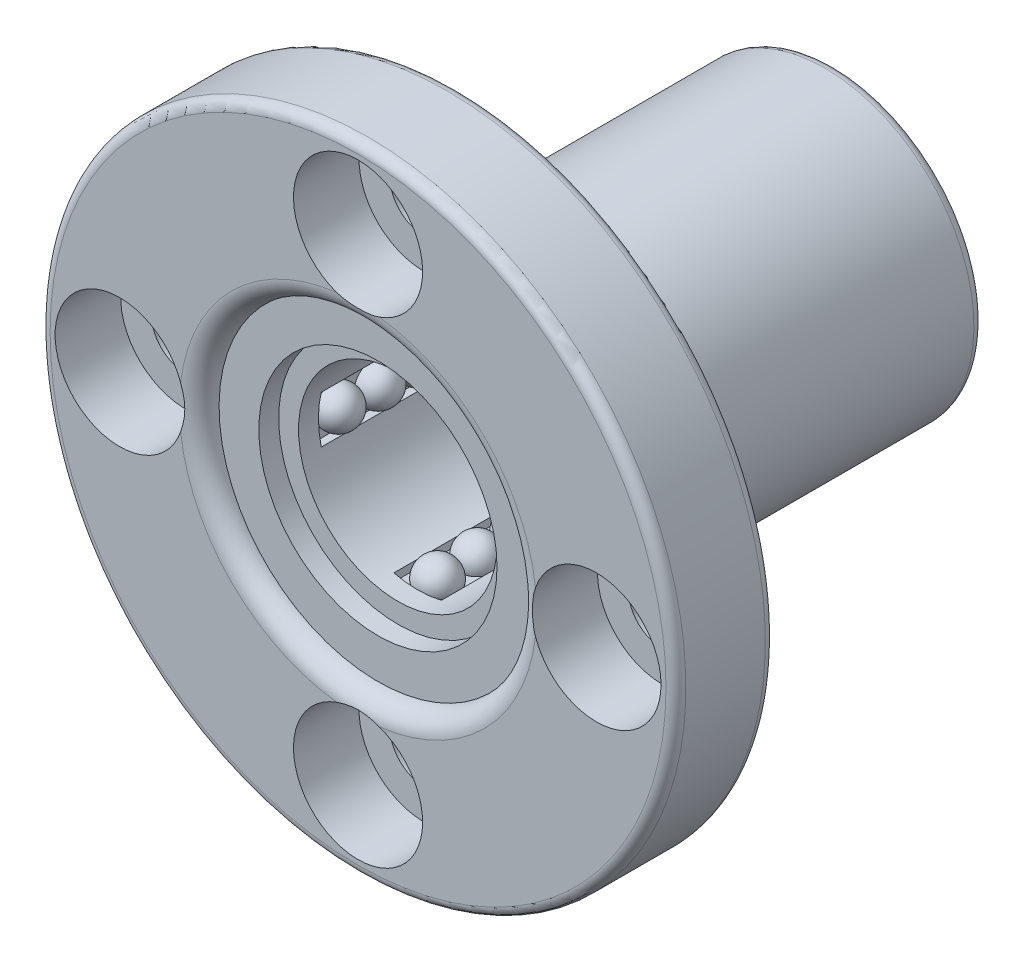
from build123d import *

# Parameters (mm, degrees)
REVOLVE_START            = -24
REVOLVE_1_OUTLINE_R      = 7.5
REVOLVE_1_DEPTH          = 24
REVOLVE_START_2          = -5
REVOLVE_1_2_OUTLINE_R    = 16
REVOLVE_1_2_OUTLINE_R_2  = 7.5
REVOLVE_1_2_DEPTH        = 5
SKETCH_16_R              = 3.25
CUT_EXTRUDE_11_DEPTH     = 3.3
SKETCH_17_R              = 1.7
CUT_EXTRUDE_12_DEPTH     = 5
SKETCH_4_R               = 4.995
CUT_EXTRUDE_1_DEPTH      = 24
SKETCH_5_R               = 7.995
CUT_EXTRUDE_2_DEPTH      = 1
SKETCH_6_R               = 5.995
CUT_EXTRUDE_3_DEPTH      = 1
FILLET_1_R               = 0.5
FILLET_2_R               = 1
SKETCH_8_W               = 2.39
SKETCH_8_H               = 0.5
CUT_EXTRUDE_4_DEPTH      = 19.01
PATTERN_LINEAR_2_COUNT   = 10
PATTERN_LINEAR_2_PITCH   = 2.01
PATTERN_CIRCULAR_2_COUNT = 4


# Read off the part's stored shape, not the designer's step: 旋转1, 旋转2
with BuildPart() as part:
    # 旋转1 outline → 旋转1 (new body)
    with BuildSketch(Plane.XY.offset(REVOLVE_START)):
        Circle(REVOLVE_1_OUTLINE_R)
    extrude(amount=REVOLVE_1_DEPTH)

    # Revolve 1 2 outline → Revolve 1 2 (add)
    with BuildSketch(Plane.XY.offset(REVOLVE_START_2)):
        Circle(REVOLVE_1_2_OUTLINE_R)
        Circle(REVOLVE_1_2_OUTLINE_R_2, mode=Mode.SUBTRACT)
    extrude(amount=REVOLVE_1_2_DEPTH)

    # 草图16 → 切除-拉伸11 (cut)
    with BuildSketch(Plane.XY):
        with Locations((0, 12)):
            Circle(SKETCH_16_R)
        with Locations((12, 0)):
            Circle(SKETCH_16_R)
        with Locations((-12, 0)):
            Circle(SKETCH_16_R)
        with Locations((0, -12)):
            Circle(SKETCH_16_R)
    extrude(amount=-CUT_EXTRUDE_11_DEPTH, mode=Mode.SUBTRACT)

    # 草图17 → 切除-拉伸12 (cut)
    with BuildSketch(Plane.XY):
        with Locations((12, 0)):
            Circle(SKETCH_17_R)
        with Locations((0, -12)):
            Circle(SKETCH_17_R)
        with Locations((-12, 0)):
            Circle(SKETCH_17_R)
        with Locations((0, 12)):
            Circle(SKETCH_17_R)
    extrude(amount=-CUT_EXTRUDE_12_DEPTH, mode=Mode.SUBTRACT)

    # 草图4 → 切除-拉伸1 (cut)
    with BuildSketch(Plane.XY):
        Circle(SKETCH_4_R)
    extrude(amount=-CUT_EXTRUDE_1_DEPTH, mode=Mode.SUBTRACT)

    # 草图5 → 切除-拉伸2 (cut)
    with BuildSketch(Plane.XY):
        Circle(SKETCH_5_R)
    extrude(amount=-CUT_EXTRUDE_2_DEPTH, mode=Mode.SUBTRACT)

    # 草图6 → 切除-拉伸3 (cut)
    with BuildSketch(Plane.XY.offset(-1)):
        Circle(SKETCH_6_R)
    extrude(amount=-CUT_EXTRUDE_3_DEPTH, mode=Mode.SUBTRACT)

    # 圆角1
    fillet_1_edges = [part.edges().sort_by_distance(p)[0] for p in [
        (-7.5, 0, -24),
        (-16, 0, -5),
        (-16, 0, 0),
    ]]
    fillet(fillet_1_edges, radius=FILLET_1_R)

    # 圆角2
    # the kernel refuses this fillet: 1 mm, written as the material it takes off along each edge
    with BuildSketch(Plane(origin=(0, 0, 0), x_dir=(1, 0, 0), z_dir=(0, -1, 0))) as fillet_2_piece_1:
        with BuildLine():
            CenterArc((7.995 + FILLET_2_R, -FILLET_2_R), FILLET_2_R, 90, 90)
            Line((7.995, -FILLET_2_R), (7.995, 0))
            Line((7.995, 0), (7.995 + FILLET_2_R, 0))
        make_face()
    revolve(axis=Axis((0, 0, 0), (0, 0, 1)), mode=Mode.SUBTRACT)

    # 草图8 → 切除-拉伸4 (cut)
    with BuildSketch(Plane.XY.offset(-3)):
        with Locations((0, 4.995)):
            Rectangle(SKETCH_8_W, SKETCH_8_H)
    cut_extrude_4 = extrude(amount=-CUT_EXTRUDE_4_DEPTH, mode=Mode.SUBTRACT)

    # 旋转2 outline → 旋转2 (revolve)
    with BuildSketch(Plane.XY.offset(-4)):
        with BuildLine():
            Line((0, 5.245000001), (0, 4.005))
            ThreePointArc((0, 4.005), (0.785429819, 4.389160414), (0.964365076, 5.245000001))
            Line((0.964365076, 5.245000001), (0, 5.245000001))
        make_face()
    revolve_2 = revolve(axis=Axis((0, 0, -4), (0, 1, 0)))

    # 阵列(线性)2: 旋转2 ×10
    with Locations(*[(0, 0, -i * PATTERN_LINEAR_2_PITCH) for i in range(1, PATTERN_LINEAR_2_COUNT)]):
        add(revolve_2)

    # 阵列(圆周)2: 切除-拉伸4, 旋转2 ×4 about axis
    pattern_circular_2_axis = Axis((0, 0, 0), (0, 0, 1))
    add([cut_extrude_4.rotate(pattern_circular_2_axis, i * 360 / PATTERN_CIRCULAR_2_COUNT) for i in range(1, PATTERN_CIRCULAR_2_COUNT)], mode=Mode.SUBTRACT)
    add([revolve_2.rotate(pattern_circular_2_axis, i * 360 / PATTERN_CIRCULAR_2_COUNT) for i in range(1, PATTERN_CIRCULAR_2_COUNT)])

    # 阵列(圆周)2 copy 1 sketch → 阵列(圆周)2 copy 1 (revolve)
    with BuildSketch(Plane(origin=(0, 0, -6.01), x_dir=(0, 1, 0), z_dir=(0, 0, 1))):
        with BuildLine():
            Line((0, 5.245000001), (0, 4.005))
            ThreePointArc((0, 4.005), (0.785429819, 4.389160414), (0.964365076, 5.245000001))
            Line((0.964365076, 5.245000001), (0, 5.245000001))
        make_face()
    revolve(axis=Axis((0, 0, -6.01), (-1, 0, 0)))

    # 阵列(圆周)2 copy 2 sketch → 阵列(圆周)2 copy 2 (revolve)
    with BuildSketch(Plane(origin=(0, 0, -6.01), x_dir=(-1, 0, 0), z_dir=(0, 0, 1))):
        with BuildLine():
            Line((0, 5.245000001), (0, 4.005))
            ThreePointArc((0, 4.005), (0.785429819, 4.389160414), (0.964365076, 5.245000001))
            Line((0.964365076, 5.245000001), (0, 5.245000001))
        make_face()
    revolve(axis=Axis((0, 0, -6.01), (0, -1, 0)))

    # 阵列(圆周)2 copy 3 sketch → 阵列(圆周)2 copy 3 (revolve)
    with BuildSketch(Plane(origin=(0, 0, -6.01), x_dir=(0, -1, 0), z_dir=(0, 0, 1))):
        with BuildLine():
            Line((0, 5.245000001), (0, 4.005))
            ThreePointArc((0, 4.005), (0.785429819, 4.389160414), (0.964365076, 5.245000001))
            Line((0.964365076, 5.245000001), (0, 5.245000001))
        make_face()
    revolve(axis=Axis((0, 0, -6.01), (1, 0, 0)))

    # 阵列(圆周)2 copy 4 sketch → 阵列(圆周)2 copy 4 (revolve)
    with BuildSketch(Plane(origin=(0, 0, -8.02), x_dir=(0, 1, 0), z_dir=(0, 0, 1))):
        with BuildLine():
            Line((0, 5.245000001), (0, 4.005))
            ThreePointArc((0, 4.005), (0.785429819, 4.389160414), (0.964365076, 5.245000001))
            Line((0.964365076, 5.245000001), (0, 5.245000001))
        make_face()
    revolve(axis=Axis((0, 0, -8.02), (-1, 0, 0)))

    # 阵列(圆周)2 copy 5 sketch → 阵列(圆周)2 copy 5 (revolve)
    with BuildSketch(Plane(origin=(0, 0, -8.02), x_dir=(-1, 0, 0), z_dir=(0, 0, 1))):
        with BuildLine():
            Line((0, 5.245000001), (0, 4.005))
            ThreePointArc((0, 4.005), (0.785429819, 4.389160414), (0.964365076, 5.245000001))
            Line((0.964365076, 5.245000001), (0, 5.245000001))
        make_face()
    revolve(axis=Axis((0, 0, -8.02), (0, -1, 0)))

    # 阵列(圆周)2 copy 6 sketch → 阵列(圆周)2 copy 6 (revolve)
    with BuildSketch(Plane(origin=(0, 0, -8.02), x_dir=(0, -1, 0), z_dir=(0, 0, 1))):
        with BuildLine():
            Line((0, 5.245000001), (0, 4.005))
            ThreePointArc((0, 4.005), (0.785429819, 4.389160414), (0.964365076, 5.245000001))
            Line((0.964365076, 5.245000001), (0, 5.245000001))
        make_face()
    revolve(axis=Axis((0, 0, -8.02), (1, 0, 0)))

    # 阵列(圆周)2 copy 7 sketch → 阵列(圆周)2 copy 7 (revolve)
    with BuildSketch(Plane(origin=(0, 0, -10.03), x_dir=(0, 1, 0), z_dir=(0, 0, 1))):
        with BuildLine():
            Line((0, 5.245000001), (0, 4.005))
            ThreePointArc((0, 4.005), (0.785429819, 4.389160414), (0.964365076, 5.245000001))
            Line((0.964365076, 5.245000001), (0, 5.245000001))
        make_face()
    revolve(axis=Axis((0, 0, -10.03), (-1, 0, 0)))

    # 阵列(圆周)2 copy 8 sketch → 阵列(圆周)2 copy 8 (revolve)
    with BuildSketch(Plane(origin=(0, 0, -10.03), x_dir=(-1, 0, 0), z_dir=(0, 0, 1))):
        with BuildLine():
            Line((0, 5.245000001), (0, 4.005))
            ThreePointArc((0, 4.005), (0.785429819, 4.389160414), (0.964365076, 5.245000001))
            Line((0.964365076, 5.245000001), (0, 5.245000001))
        make_face()
    revolve(axis=Axis((0, 0, -10.03), (0, -1, 0)))

    # 阵列(圆周)2 copy 9 sketch → 阵列(圆周)2 copy 9 (revolve)
    with BuildSketch(Plane(origin=(0, 0, -10.03), x_dir=(0, -1, 0), z_dir=(0, 0, 1))):
        with BuildLine():
            Line((0, 5.245000001), (0, 4.005))
            ThreePointArc((0, 4.005), (0.785429819, 4.389160414), (0.964365076, 5.245000001))
            Line((0.964365076, 5.245000001), (0, 5.245000001))
        make_face()
    revolve(axis=Axis((0, 0, -10.03), (1, 0, 0)))

    # 阵列(圆周)2 copy 10 sketch → 阵列(圆周)2 copy 10 (revolve)
    with BuildSketch(Plane(origin=(0, 0, -12.04), x_dir=(0, 1, 0), z_dir=(0, 0, 1))):
        with BuildLine():
            Line((0, 5.245000001), (0, 4.005))
            ThreePointArc((0, 4.005), (0.785429819, 4.389160414), (0.964365076, 5.245000001))
            Line((0.964365076, 5.245000001), (0, 5.245000001))
        make_face()
    revolve(axis=Axis((0, 0, -12.04), (-1, 0, 0)))

    # 阵列(圆周)2 copy 11 sketch → 阵列(圆周)2 copy 11 (revolve)
    with BuildSketch(Plane(origin=(0, 0, -12.04), x_dir=(-1, 0, 0), z_dir=(0, 0, 1))):
        with BuildLine():
            Line((0, 5.245000001), (0, 4.005))
            ThreePointArc((0, 4.005), (0.785429819, 4.389160414), (0.964365076, 5.245000001))
            Line((0.964365076, 5.245000001), (0, 5.245000001))
        make_face()
    revolve(axis=Axis((0, 0, -12.04), (0, -1, 0)))

    # 阵列(圆周)2 copy 12 sketch → 阵列(圆周)2 copy 12 (revolve)
    with BuildSketch(Plane(origin=(0, 0, -12.04), x_dir=(0, -1, 0), z_dir=(0, 0, 1))):
        with BuildLine():
            Line((0, 5.245000001), (0, 4.005))
            ThreePointArc((0, 4.005), (0.785429819, 4.389160414), (0.964365076, 5.245000001))
            Line((0.964365076, 5.245000001), (0, 5.245000001))
        make_face()
    revolve(axis=Axis((0, 0, -12.04), (1, 0, 0)))

    # 阵列(圆周)2 copy 13 sketch → 阵列(圆周)2 copy 13 (revolve)
    with BuildSketch(Plane(origin=(0, 0, -14.05), x_dir=(0, 1, 0), z_dir=(0, 0, 1))):
        with BuildLine():
            Line((0, 5.245000001), (0, 4.005))
            ThreePointArc((0, 4.005), (0.785429819, 4.389160414), (0.964365076, 5.245000001))
            Line((0.964365076, 5.245000001), (0, 5.245000001))
        make_face()
    revolve(axis=Axis((0, 0, -14.05), (-1, 0, 0)))

    # 阵列(圆周)2 copy 14 sketch → 阵列(圆周)2 copy 14 (revolve)
    with BuildSketch(Plane(origin=(0, 0, -14.05), x_dir=(-1, 0, 0), z_dir=(0, 0, 1))):
        with BuildLine():
            Line((0, 5.245000001), (0, 4.005))
            ThreePointArc((0, 4.005), (0.785429819, 4.389160414), (0.964365076, 5.245000001))
            Line((0.964365076, 5.245000001), (0, 5.245000001))
        make_face()
    revolve(axis=Axis((0, 0, -14.05), (0, -1, 0)))

    # 阵列(圆周)2 copy 15 sketch → 阵列(圆周)2 copy 15 (revolve)
    with BuildSketch(Plane(origin=(0, 0, -14.05), x_dir=(0, -1, 0), z_dir=(0, 0, 1))):
        with BuildLine():
            Line((0, 5.245000001), (0, 4.005))
            ThreePointArc((0, 4.005), (0.785429819, 4.389160414), (0.964365076, 5.245000001))
            Line((0.964365076, 5.245000001), (0, 5.245000001))
        make_face()
    revolve(axis=Axis((0, 0, -14.05), (1, 0, 0)))

    # 阵列(圆周)2 copy 16 sketch → 阵列(圆周)2 copy 16 (revolve)
    with BuildSketch(Plane(origin=(0, 0, -16.06), x_dir=(0, 1, 0), z_dir=(0, 0, 1))):
        with BuildLine():
            Line((0, 5.245000001), (0, 4.005))
            ThreePointArc((0, 4.005), (0.785429819, 4.389160414), (0.964365076, 5.245000001))
            Line((0.964365076, 5.245000001), (0, 5.245000001))
        make_face()
    revolve(axis=Axis((0, 0, -16.06), (-1, 0, 0)))

    # 阵列(圆周)2 copy 17 sketch → 阵列(圆周)2 copy 17 (revolve)
    with BuildSketch(Plane(origin=(0, 0, -16.06), x_dir=(-1, 0, 0), z_dir=(0, 0, 1))):
        with BuildLine():
            Line((0, 5.245000001), (0, 4.005))
            ThreePointArc((0, 4.005), (0.785429819, 4.389160414), (0.964365076, 5.245000001))
            Line((0.964365076, 5.245000001), (0, 5.245000001))
        make_face()
    revolve(axis=Axis((0, 0, -16.06), (0, -1, 0)))

    # 阵列(圆周)2 copy 18 sketch → 阵列(圆周)2 copy 18 (revolve)
    with BuildSketch(Plane(origin=(0, 0, -16.06), x_dir=(0, -1, 0), z_dir=(0, 0, 1))):
        with BuildLine():
            Line((0, 5.245000001), (0, 4.005))
            ThreePointArc((0, 4.005), (0.785429819, 4.389160414), (0.964365076, 5.245000001))
            Line((0.964365076, 5.245000001), (0, 5.245000001))
        make_face()
    revolve(axis=Axis((0, 0, -16.06), (1, 0, 0)))

    # 阵列(圆周)2 copy 19 sketch → 阵列(圆周)2 copy 19 (revolve)
    with BuildSketch(Plane(origin=(0, 0, -18.07), x_dir=(0, 1, 0), z_dir=(0, 0, 1))):
        with BuildLine():
            Line((0, 5.245000001), (0, 4.005))
            ThreePointArc((0, 4.005), (0.785429819, 4.389160414), (0.964365076, 5.245000001))
            Line((0.964365076, 5.245000001), (0, 5.245000001))
        make_face()
    revolve(axis=Axis((0, 0, -18.07), (-1, 0, 0)))

    # 阵列(圆周)2 copy 20 sketch → 阵列(圆周)2 copy 20 (revolve)
    with BuildSketch(Plane(origin=(0, 0, -18.07), x_dir=(-1, 0, 0), z_dir=(0, 0, 1))):
        with BuildLine():
            Line((0, 5.245000001), (0, 4.005))
            ThreePointArc((0, 4.005), (0.785429819, 4.389160414), (0.964365076, 5.245000001))
            Line((0.964365076, 5.245000001), (0, 5.245000001))
        make_face()
    revolve(axis=Axis((0, 0, -18.07), (0, -1, 0)))

    # 阵列(圆周)2 copy 21 sketch → 阵列(圆周)2 copy 21 (revolve)
    with BuildSketch(Plane(origin=(0, 0, -18.07), x_dir=(0, -1, 0), z_dir=(0, 0, 1))):
        with BuildLine():
            Line((0, 5.245000001), (0, 4.005))
            ThreePointArc((0, 4.005), (0.785429819, 4.389160414), (0.964365076, 5.245000001))
            Line((0.964365076, 5.245000001), (0, 5.245000001))
        make_face()
    revolve(axis=Axis((0, 0, -18.07), (1, 0, 0)))

    # 阵列(圆周)2 copy 22 sketch → 阵列(圆周)2 copy 22 (revolve)
    with BuildSketch(Plane(origin=(0, 0, -20.08), x_dir=(0, 1, 0), z_dir=(0, 0, 1))):
        with BuildLine():
            Line((0, 5.245000001), (0, 4.005))
            ThreePointArc((0, 4.005), (0.785429819, 4.389160414), (0.964365076, 5.245000001))
            Line((0.964365076, 5.245000001), (0, 5.245000001))
        make_face()
    revolve(axis=Axis((0, 0, -20.08), (-1, 0, 0)))

    # 阵列(圆周)2 copy 23 sketch → 阵列(圆周)2 copy 23 (revolve)
    with BuildSketch(Plane(origin=(0, 0, -20.08), x_dir=(-1, 0, 0), z_dir=(0, 0, 1))):
        with BuildLine():
            Line((0, 5.245000001), (0, 4.005))
            ThreePointArc((0, 4.005), (0.785429819, 4.389160414), (0.964365076, 5.245000001))
            Line((0.964365076, 5.245000001), (0, 5.245000001))
        make_face()
    revolve(axis=Axis((0, 0, -20.08), (0, -1, 0)))

    # 阵列(圆周)2 copy 24 sketch → 阵列(圆周)2 copy 24 (revolve)
    with BuildSketch(Plane(origin=(0, 0, -20.08), x_dir=(0, -1, 0), z_dir=(0, 0, 1))):
        with BuildLine():
            Line((0, 5.245000001), (0, 4.005))
            ThreePointArc((0, 4.005), (0.785429819, 4.389160414), (0.964365076, 5.245000001))
            Line((0.964365076, 5.245000001), (0, 5.245000001))
        make_face()
    revolve(axis=Axis((0, 0, -20.08), (1, 0, 0)))

    # 阵列(圆周)2 copy 25 sketch → 阵列(圆周)2 copy 25 (revolve)
    with BuildSketch(Plane(origin=(0, 0, -22.09), x_dir=(0, 1, 0), z_dir=(0, 0, 1))):
        with BuildLine():
            Line((0, 5.245000001), (0, 4.005))
            ThreePointArc((0, 4.005), (0.785429819, 4.389160414), (0.964365076, 5.245000001))
            Line((0.964365076, 5.245000001), (0, 5.245000001))
        make_face()
    revolve(axis=Axis((0, 0, -22.09), (-1, 0, 0)))

    # 阵列(圆周)2 copy 26 sketch → 阵列(圆周)2 copy 26 (revolve)
    with BuildSketch(Plane(origin=(0, 0, -22.09), x_dir=(-1, 0, 0), z_dir=(0, 0, 1))):
        with BuildLine():
            Line((0, 5.245000001), (0, 4.005))
            ThreePointArc((0, 4.005), (0.785429819, 4.389160414), (0.964365076, 5.245000001))
            Line((0.964365076, 5.245000001), (0, 5.245000001))
        make_face()
    revolve(axis=Axis((0, 0, -22.09), (0, -1, 0)))

    # 阵列(圆周)2 copy 27 sketch → 阵列(圆周)2 copy 27 (revolve)
    with BuildSketch(Plane(origin=(0, 0, -22.09), x_dir=(0, -1, 0), z_dir=(0, 0, 1))):
        with BuildLine():
            Line((0, 5.245000001), (0, 4.005))
            ThreePointArc((0, 4.005), (0.785429819, 4.389160414), (0.964365076, 5.245000001))
            Line((0.964365076, 5.245000001), (0, 5.245000001))
        make_face()
    revolve(axis=Axis((0, 0, -22.09), (1, 0, 0)))


solid = part.part
